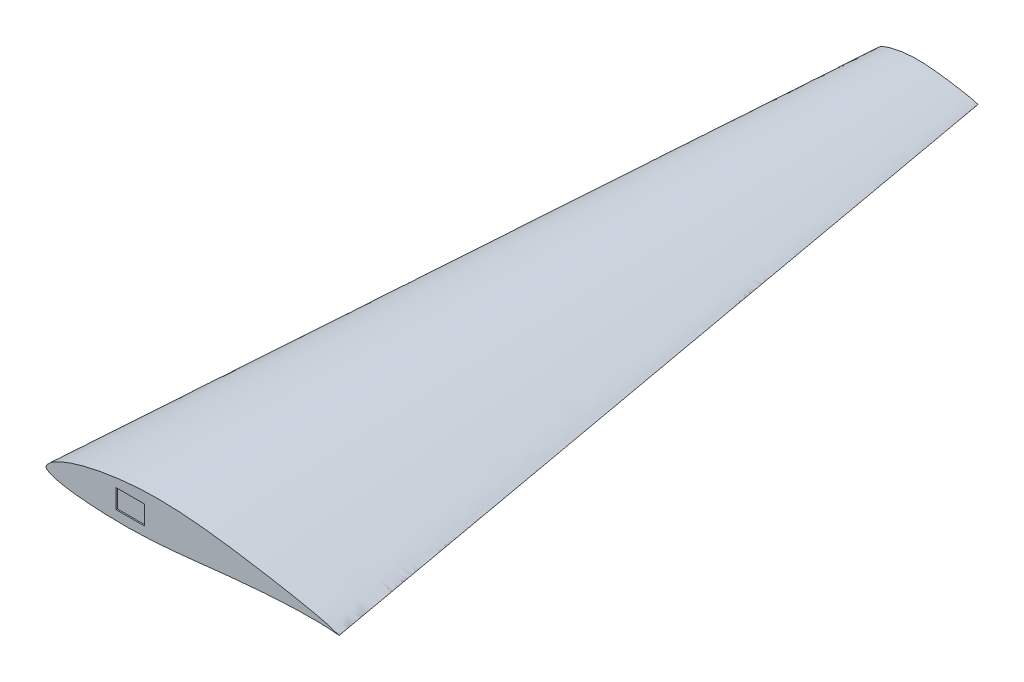
from build123d import *

# Parameters (mm, degrees)
SKETCH7_W           = 226.371566509
SKETCH7_H           = 151.802109306
BOSS_EXTRUDE1_DEPTH = 10
SKETCH8_W           = 2748.417136902
SKETCH8_H           = 756.347351628
CUT_EXTRUDE1_DEPTH  = 6200
SKETCH9_W           = 226.371566509
SKETCH9_H           = 151.802109306
CUT_EXTRUDE2_DEPTH  = 30


with BuildPart() as part:
    # Loft5: read off the stored shape, not the designer's step
    # Loft5: loft between two sections, ruled curve by curve
    loft5_from = [
        Edge.make_bspline([(-1162.800936811, -35.163192179, 0), (-1162.822183798, -35.414868488, 0), (-1162.871898932, -36.228422016, 0), (-1162.848768247, -37.387058554, 0), (-1162.61538645, -38.826082959, 0), (-1162.201221762, -40.015332681, 0), (-1161.541560756, -41.350118911, 0), (-1160.495072558, -43.051764041, 0), (-1159.10433634, -44.765798406, 0), (-1156.573193359, -47.505841636, 0), (-1154.176950055, -49.652330773, 0), (-1148.637582442, -54.050269875, 0), (-1143.937900782, -57.032412546, 0), (-1132.685026898, -63.285660798, 0), (-1124.41666858, -66.897956201, 0), (-1104.079931564, -74.696993074, 0), (-1090.221699782, -78.868905791, 0), (-1060.427840202, -86.637236656, 0), (-1042.796474444, -90.371614383, 0), (-1005.566204742, -97.230960043, 0), (-984.279801733, -100.463443592, 0), (-939.968877174, -106.391496045, 0), (-915.262534533, -109.185210548, 0), (-864.426937653, -114.192374734, 0), (-836.616183645, -116.479005489, 0), (-779.921918044, -120.435595606, 0), (-749.356989549, -122.153094567, 0), (-687.52667164, -124.932885195, 0), (-654.579763498, -126.015577223, 0), (-588.388676331, -127.403034993, 0), (-553.463082382, -127.694050614, 0), (-483.59241304, -127.330405119, 0), (-446.966886676, -126.619332334, 0), (-373.90611349, -124.163065894, 0), (-335.792606005, -122.317057011, 0), (-259.889195453, -117.538593796, 0), (-220.424449688, -114.46019645, 0), (-141.813544032, -107.414278533, 0), (-100.995999182, -103.267123309, 0), (-19.895972992, -94.702578227, 0), (22.057286838, -90.101292193, 0), (104.877431201, -80.990004598, 0), (147.415245349, -76.297447999, 0), (230.814160738, -67.315520805, 0), (273.346545619, -62.84695844, 0), (356.10424868, -54.508553815, 0), (398.001483146, -50.465820419, 0), (478.837616493, -43.199400276, 0), (519.449125211, -39.808815896, 0), (597.039432074, -33.946485822, 0), (635.691758147, -31.317857121, 0), (708.697181241, -27.008710655, 0), (744.726286705, -25.184484347, 0), (811.896313394, -22.527116942, 0), (844.710262782, -21.558723345, 0), (904.722881392, -20.45314693, 0), (933.61491527, -20.206493771, 0), (985.645245963, -20.513342652, 0), (1010.408946885, -20.956951597, 0), (1052.553651817, -22.115469079, 0), (1071.818915088, -22.809811049, 0), (1105.862928415, -24.946014141, 0), (1121.636551476, -26.195956513, 0), (1140.693356673, -27.498377131, 0), (1147.84079961, -27.998100854, 0), (1163.450520733, -30.424755632, 0), (1167.93232743, -31.12150071, 0), (1166.333250942, -30.383643554, 0), (1161.244272241, -29.02459427, 0), (1148.212054596, -25.284802368, 0), (1142.250057716, -22.91680023, 0), (1126.124720652, -16.967785614, 0), (1113.324866408, -12.612433811, 0), (1086.921596361, -4.120540482, 0), (1071.946000262, 0.300240412, 0), (1039.417482915, 9.038126416, 0), (1020.102787094, 13.631531736, 0), (979.550729393, 22.878805934, 0), (956.686338928, 27.826750356, 0), (909.142474659, 37.808538495, 0), (882.801663806, 43.145917162, 0), (828.767605393, 53.835472704, 0), (799.421575983, 59.484710099, 0), (739.759899582, 70.711922498, 0), (707.787802745, 76.578611377, 0), (643.314129891, 88.151483328, 0), (609.155063789, 94.137021182, 0), (540.770148943, 105.789438396, 0), (504.884536406, 111.722376626, 0), (433.487022724, 123.150696314, 0), (396.313239717, 128.898232321, 0), (322.81434593, 139.781582104, 0), (284.824972879, 145.153060386, 0), (210.123992236, 155.100796983, 0), (171.745512805, 159.893086791, 0), (96.706219557, 168.529980342, 0), (58.375778891, 172.567678134, 0), (-16.17059387, 179.473166352, 0), (-54.058965393, 182.506744355, 0), (-127.448992254, 187.121752683, 0), (-164.626196781, 188.834346007, 0), (-236.415468718, 190.765176351, 0), (-272.706452707, 191.062320544, 0), (-342.564213532, 190.140218642, 0), (-377.81178065, 188.94185446, 0), (-445.467692408, 185.169528348, 0), (-479.556593178, 182.549213038, 0), (-544.69112978, 176.257317419, 0), (-577.414316944, 172.472558942, 0), (-639.493609113, 164.140251588, 0), (-670.522545441, 159.423235882, 0), (-728.886946081, 149.357823597, 0), (-757.890432248, 143.793924517, 0), (-811.926857082, 132.25879948, 0), (-838.620463172, 126.018346936, 0), (-887.766697444, 113.31194864, 0), (-911.871750104, 106.525905965, 0), (-955.610192817, 92.920910192, 0), (-976.88571477, 85.727064576, 0), (-1014.732715268, 71.532461313, 0), (-1032.933976204, 64.097106753, 0), (-1064.487413407, 49.569322922, 0), (-1079.454267496, 41.980719272, 0), (-1104.414509767, 27.405440345, 0), (-1116.007233797, 19.835377741, 0), (-1134.271241421, 5.644140528, 0), (-1142.482810192, -1.674468425, 0), (-1150.05757818, -10.507334837, 0), (-1151.570612501, -12.367319637, 0), (-1155.098408922, -16.987708824, 0), (-1157.863777854, -21.293897064, 0), (-1160.65973822, -27.115735448, 0), (-1161.754496193, -29.957647604, 0), (-1162.534876593, -33.10376266, 0), (-1162.737194787, -34.408150679, 0), (-1162.800936811, -35.163192179, 0)], [0, 0, 0, 0, 0.000158858, 0.000512164, 0.000723803, 0.00107711, 0.001302238, 0.001655545, 0.002333877, 0.002687183, 0.00400362, 0.004356926, 0.007144152, 0.007497458, 0.012464278, 0.012817584, 0.021220552, 0.021573858, 0.032223796, 0.032577102, 0.045442075, 0.045795381, 0.060764694, 0.061118, 0.078005039, 0.078358345, 0.096953849, 0.097307155, 0.117385453, 0.117738759, 0.139053693, 0.139407, 0.161796849, 0.162150155, 0.185501716, 0.185855022, 0.210106345, 0.210459652, 0.235623072, 0.235976379, 0.261883226, 0.262236532, 0.288515909, 0.288869215, 0.31512997, 0.315483276, 0.341318171, 0.341671477, 0.366662093, 0.367015399, 0.390736041, 0.391089347, 0.413133747, 0.413487053, 0.433466039, 0.433819346, 0.451372334, 0.45172564, 0.466514145, 0.466867452, 0.478637876, 0.478991182, 0.487516787, 0.487870093, 0.492959922, 0.493313228, 0.49479887, 0.495152176, 0.496579124, 0.496932431, 0.501575489, 0.501928795, 0.509106502, 0.509459808, 0.518845117, 0.519198423, 0.530915273, 0.53126858, 0.545345843, 0.545699149, 0.561928754, 0.56228206, 0.580423299, 0.580776605, 0.600566162, 0.600919468, 0.622080968, 0.622434275, 0.644662984, 0.64501629, 0.66802863, 0.668381936, 0.691867948, 0.692221254, 0.715901904, 0.71625521, 0.739850827, 0.740204134, 0.76346205, 0.763815356, 0.786571668, 0.786924974, 0.809097378, 0.809450685, 0.830976381, 0.831329688, 0.852176229, 0.852529536, 0.872590541, 0.872943847, 0.892023758, 0.892377064, 0.910288183, 0.910641489, 0.927216198, 0.927569504, 0.942648105, 0.943001411, 0.956449628, 0.956802934, 0.968485862, 0.968839169, 0.978697266, 0.979050572, 0.987061378, 0.987414684, 0.993595691, 0.993948997, 0.994753897, 0.995107204, 0.997609477, 0.997962784, 0.999170113, 0.999523419, 1, 1, 1, 1], 3),
    ]
    loft5_to = [
        Edge.make_bspline([(-751.127407138, -47.646450923, 6200), (-751.141425132, -47.731701038, 6200), (-751.181479745, -48.007349219, 6200), (-751.212003011, -48.400212637, 6200), (-751.205936582, -48.902236553, 6200), (-751.149350948, -49.329465992, 6200), (-750.994737817, -49.811820136, 6200), (-750.69310225, -50.431282994, 6200), (-750.256246487, -51.045969648, 6200), (-749.416488377, -52.010755452, 6200), (-748.611427802, -52.761584437, 6200), (-746.73086348, -54.287926497, 6200), (-745.127778881, -55.315521698, 6200), (-741.271616254, -57.451893168, 6200), (-738.436071417, -58.674361062, 6200), (-731.452005928, -61.28610243, 6200), (-726.694952759, -62.667060725, 6200), (-716.466679165, -65.209751508, 6200), (-710.416790484, -66.415088778, 6200), (-697.644342596, -68.600756178, 6200), (-690.344479221, -69.611682633, 6200), (-675.151371616, -71.436270257, 6200), (-666.682488131, -72.277308383, 6200), (-649.260178746, -73.751704674, 6200), (-639.731015486, -74.402627498, 6200), (-620.308326956, -75.486802895, 6200), (-609.839170905, -75.928604398, 6200), (-588.664210242, -76.583675373, 6200), (-577.382832209, -76.796294591, 6200), (-554.722067026, -76.953786876, 6200), (-542.767268644, -76.886108019, 6200), (-518.855535363, -76.427358696, 6200), (-506.323726288, -76.008756046, 6200), (-481.330177816, -74.818526637, 6200), (-468.29453437, -74.00430387, 6200), (-442.339202583, -72.005445654, 6200), (-428.847066353, -70.762228889, 6200), (-401.976193921, -67.971675754, 6200), (-388.026457908, -66.353929852, 6200), (-360.311756195, -63.025470298, 6200), (-345.975801609, -61.244463522, 6200), (-317.675438659, -57.71760724, 6200), (-303.140030242, -55.901194166, 6200), (-274.64121352, -52.413546609, 6200), (-260.106661837, -50.672935607, 6200), (-231.824260001, -47.407455683, 6200), (-217.505056961, -45.814966276, 6200), (-189.875157788, -42.924178108, 6200), (-175.992823604, -41.560556741, 6200), (-149.466929055, -39.165391295, 6200), (-136.251337684, -38.071782211, 6200), (-111.286803427, -36.230090033, 6200), (-98.965105274, -35.424161848, 6200), (-75.989967226, -34.175170143, 6200), (-64.764072704, -33.677660304, 6200), (-44.229229766, -32.995122157, 6200), (-34.343056361, -32.763382861, 6200), (-16.538258232, -32.601555003, 6200), (-8.05769346, -32.626935881, 6200), (6.385837086, -32.809037312, 6200), (12.97290427, -32.944349073, 6200), (24.591679793, -33.488374438, 6200), (30.030060425, -33.838730721, 6200), (36.68993115, -34.204579094, 6200), (39.034036697, -34.311166181, 6200), (44.073344639, -34.987900882, 6200), (45.927247352, -35.265215584, 6200), (46.468035896, -35.238418769, 6200), (45.024469602, -34.862364293, 6200), (40.234120624, -33.603433343, 6200), (38.07946271, -32.80994025, 6200), (32.655380595, -30.878800399, 6200), (28.285312988, -29.453284575, 6200), (19.172424622, -26.650341903, 6200), (14.018896651, -25.199296771, 6200), (2.859749783, -22.352634015, 6200), (-3.76900719, -20.869046961, 6200), (-17.695751063, -17.895906333, 6200), (-25.54564439, -16.31180281, 6200), (-41.864822426, -13.125457918, 6200), (-50.905693723, -11.426531929, 6200), (-69.451327564, -8.030998734, 6200), (-79.522670229, -6.240572572, 6200), (-99.996716228, -2.689257219, 6200), (-110.967871892, -0.837558428, 6200), (-133.090718616, 2.80806841, 6200), (-144.810978199, 4.689733268, 6200), (-168.272744519, 8.34388716, 6200), (-180.583631154, 10.199264824, 6200), (-205.075357182, 13.762168612, 6200), (-217.826185503, 15.548053992, 6200), (-243.034336985, 18.91501172, 6200), (-256.06240455, 20.56872842, 6200), (-281.677276649, 23.610796864, 6200), (-294.835635649, 25.064984745, 6200), (-320.559817263, 27.657899897, 6200), (-333.698000986, 28.854926004, 6200), (-359.244905506, 30.859896083, 6200), (-372.226857308, 31.716874049, 6200), (-397.366811805, 32.947010661, 6200), (-410.098991872, 33.356641239, 6200), (-434.678287394, 33.677542349, 6200), (-447.100446372, 33.607926016, 6200), (-471.005220483, 32.96359131, 6200), (-483.063233533, 32.387754572, 6200), (-506.20108055, 30.778982811, 6200), (-517.855832223, 29.721818889, 6200), (-540.118788289, 27.261468573, 6200), (-551.300593789, 25.811809028, 6200), (-572.508172184, 22.667090059, 6200), (-583.105791709, 20.906726386, 6200), (-603.034084244, 17.188201501, 6200), (-612.934669547, 15.148363328, 6200), (-631.375133313, 10.948584903, 6200), (-640.48228119, 8.689126763, 6200), (-657.244351257, 4.114131131, 6200), (-665.463564111, 1.681731434, 6200), (-680.37191932, -3.171909182, 6200), (-687.621764667, -5.728454315, 6200), (-700.513224708, -10.751709364, 6200), (-706.711546364, -13.373193996, 6200), (-717.45173122, -18.47336174, 6200), (-722.545778818, -21.12763347, 6200), (-731.03727156, -26.204324501, 6200), (-734.982039139, -28.830667966, 6200), (-741.194715598, -33.73310934, 6200), (-743.997220988, -36.25019478, 6200), (-746.590147531, -39.272983414, 6200), (-747.109292328, -39.908239355, 6200), (-748.322705006, -41.483173753, 6200), (-749.284306226, -42.948163639, 6200), (-750.272684648, -44.924056037, 6200), (-750.675662256, -45.886522389, 6200), (-750.987134729, -46.949220976, 6200), (-751.085352453, -47.390696319, 6200), (-751.127407138, -47.646450923, 6200)], [0, 0, 0, 0, 0.000158858, 0.000512164, 0.000723803, 0.00107711, 0.001302238, 0.001655545, 0.002333877, 0.002687183, 0.00400362, 0.004356926, 0.007144152, 0.007497458, 0.012464278, 0.012817584, 0.021220552, 0.021573858, 0.032223796, 0.032577102, 0.045442075, 0.045795381, 0.060764694, 0.061118, 0.078005039, 0.078358345, 0.096953849, 0.097307155, 0.117385453, 0.117738759, 0.139053693, 0.139407, 0.161796849, 0.162150155, 0.185501716, 0.185855022, 0.210106345, 0.210459652, 0.235623072, 0.235976379, 0.261883226, 0.262236532, 0.288515909, 0.288869215, 0.31512997, 0.315483276, 0.341318171, 0.341671477, 0.366662093, 0.367015399, 0.390736041, 0.391089347, 0.413133747, 0.413487053, 0.433466039, 0.433819346, 0.451372334, 0.45172564, 0.466514145, 0.466867452, 0.478637876, 0.478991182, 0.487516787, 0.487870093, 0.492959922, 0.493313228, 0.49479887, 0.495152176, 0.496579124, 0.496932431, 0.501575489, 0.501928795, 0.509106502, 0.509459808, 0.518845117, 0.519198423, 0.530915273, 0.53126858, 0.545345843, 0.545699149, 0.561928754, 0.56228206, 0.580423299, 0.580776605, 0.600566162, 0.600919468, 0.622080968, 0.622434275, 0.644662984, 0.64501629, 0.66802863, 0.668381936, 0.691867948, 0.692221254, 0.715901904, 0.71625521, 0.739850827, 0.740204134, 0.76346205, 0.763815356, 0.786571668, 0.786924974, 0.809097378, 0.809450685, 0.830976381, 0.831329688, 0.852176229, 0.852529536, 0.872590541, 0.872943847, 0.892023758, 0.892377064, 0.910288183, 0.910641489, 0.927216198, 0.927569504, 0.942648105, 0.943001411, 0.956449628, 0.956802934, 0.968485862, 0.968839169, 0.978697266, 0.979050572, 0.987061378, 0.987414684, 0.993595691, 0.993948997, 0.994753897, 0.995107204, 0.997609477, 0.997962784, 0.999170113, 0.999523419, 1, 1, 1, 1], 3),
    ]
    loft5 = Solid(Shell([*[Face.make_surface_from_curves(loft5_from[k], loft5_to[k]) for k in range(1)], Face(Wire(loft5_from)), Face(Wire(loft5_to))]))
    add(loft5)

    # Sketch7 → Boss-Extrude1 (add)
    with BuildSketch(Plane(origin=(0, 0, 0), x_dir=(-1, 0, 0), z_dir=(0, 0, -1))):
        with Locations((491.847907021, 24.970484801)):
            Rectangle(SKETCH7_W, SKETCH7_H)
    extrude(amount=BOSS_EXTRUDE1_DEPTH)

    # Mirror1: part across plane


with BuildPart() as part_1:
    add(part.part)
    add(part.part.mirror(Plane(origin=(0, 0, -10), x_dir=(1, 0, 0), z_dir=(0, 0, -1))))

    # Sketch8 → Cut-Extrude1 (cut)
    with BuildSketch(Plane.XY.offset(6200)):
        with Locations((-101.689854156, -77.562518853)):
            Rectangle(SKETCH8_W, SKETCH8_H)
    extrude(amount=-CUT_EXTRUDE1_DEPTH, mode=Mode.SUBTRACT)

    # Sketch9 → Cut-Extrude2 (cut)
    with BuildSketch(Plane.XY):
        with Locations((-491.847907021, 24.970484801)):
            Rectangle(SKETCH9_W, SKETCH9_H)
    extrude(amount=-CUT_EXTRUDE2_DEPTH, mode=Mode.SUBTRACT)


solid = part_1.part
